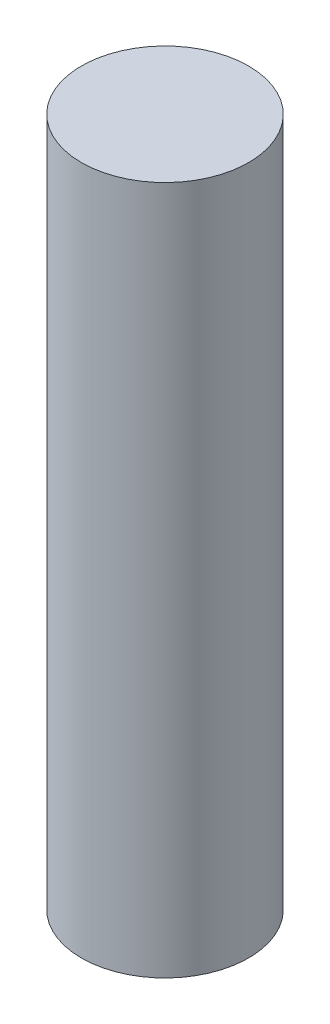
from build123d import *

# Parameters (mm, degrees)
SKETCH1_R           = 8.5
BOSS_EXTRUDE1_DEPTH = 70


with BuildPart() as part:
    # Sketch1 → Boss-Extrude1 (new body)
    with BuildSketch(Plane(origin=(0, 0, 0), x_dir=(1, 0, 0), z_dir=(0, 1, 0))):
        Circle(SKETCH1_R)
    extrude(amount=BOSS_EXTRUDE1_DEPTH)


solid = part.part
